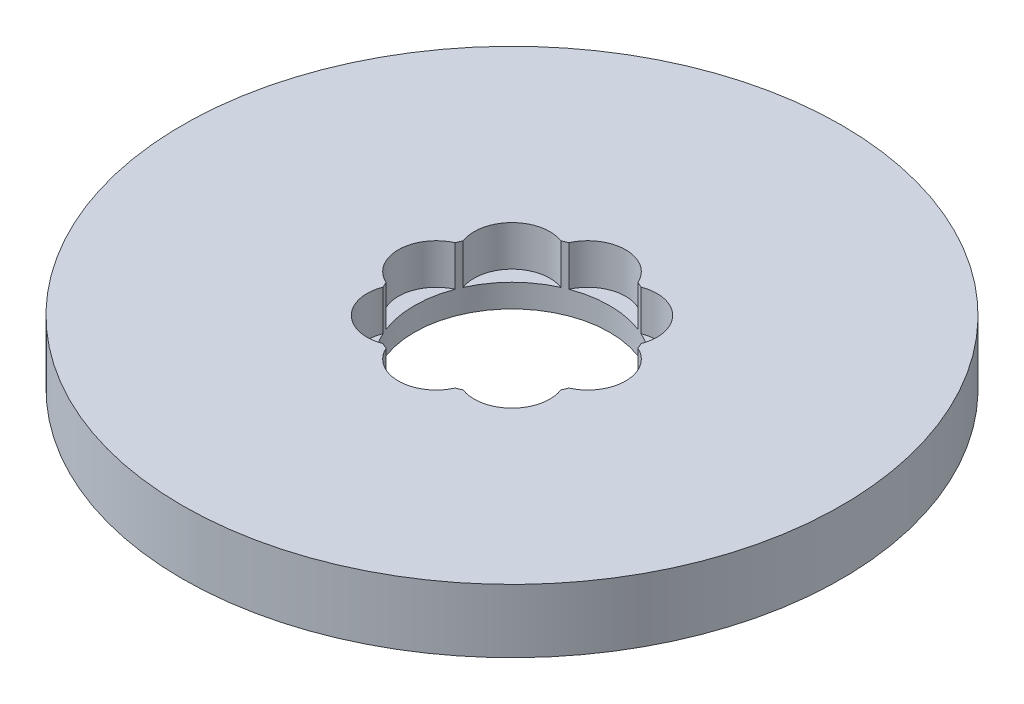
from build123d import *

# Parameters (mm, degrees)
SKETCH1_R           = 67.5
BOSS_EXTRUDE1_DEPTH = 13
SKETCH2_R           = 20
CUT_EXTRUDE1_DEPTH  = 97.340541829
SKETCH3_R           = 7.758559582
CUT_EXTRUDE2_DEPTH  = 8.26359309
CIRPATTERN1_COUNT   = 8


with BuildPart() as part:
    # Sketch1 → Boss-Extrude1 (new body)
    with BuildSketch(Plane(origin=(0, 0, 0), x_dir=(1, 0, 0), z_dir=(0, 1, 0))):
        Circle(SKETCH1_R)
    extrude(amount=BOSS_EXTRUDE1_DEPTH)

    # Sketch2 → Cut-Extrude1 (cut, through all)
    with BuildSketch(Plane(origin=(0, 0, 0), x_dir=(1, 0, 0), z_dir=(0, 1, 0))):
        Circle(SKETCH2_R)
    extrude(amount=CUT_EXTRUDE1_DEPTH, mode=Mode.SUBTRACT)

    # Sketch3 → Cut-Extrude2 (cut)
    with BuildSketch(Plane(origin=(0, 13, 0), x_dir=(1, 0, 0), z_dir=(0, 1, 0))):
        with Locations((-15.522683365, 0)):
            Circle(SKETCH3_R)
    cut_extrude2 = extrude(amount=-CUT_EXTRUDE2_DEPTH, mode=Mode.SUBTRACT)

    # CirPattern1: Cut-Extrude2 ×8 about axis
    cirpattern1_axis = Axis((0, 0, 0), (0, 1, 0))
    for i in range(1, CIRPATTERN1_COUNT):
        add(cut_extrude2.rotate(cirpattern1_axis, i * 360 / CIRPATTERN1_COUNT), mode=Mode.SUBTRACT)


solid = part.part
